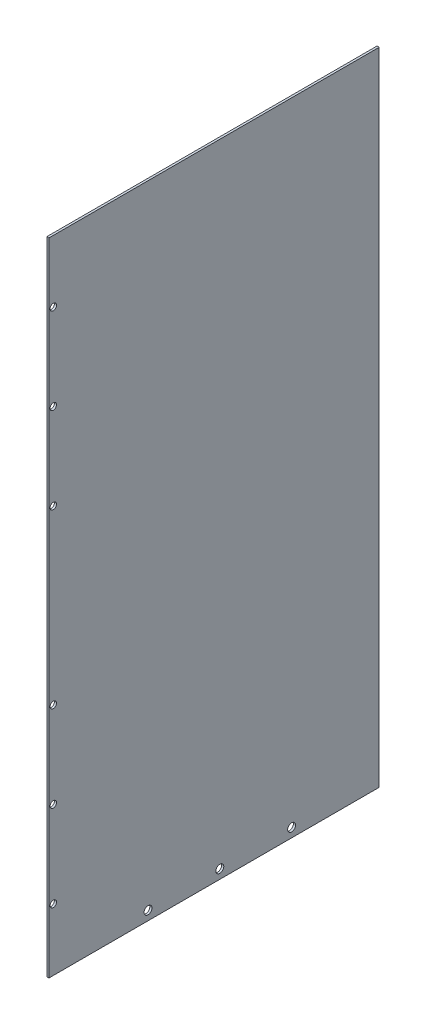
from build123d import *

# Parameters (mm, degrees)
SKETCH_1_W             = 1.5
SKETCH_1_H             = 446.43
SM_BASE_FLANGE_1_DEPTH = 230
SKETCH_10_R            = 2.75
CUT_EXTRUDE_1_DEPTH    = 20
SKETCH_11_R            = 2.25
CUT_EXTRUDE_2_DEPTH    = 10


# Sheet-metal steps are written as plain solids
with BuildPart() as part:
    # Sketch 1 → 基体-法兰1 (new body)
    with BuildSketch(Plane.XY):
        with Locations((0.75, 223.215)):
            Rectangle(SKETCH_1_W, SKETCH_1_H)
    extrude(amount=SM_BASE_FLANGE_1_DEPTH)

    # 草图10 → 切除-拉伸1 (cut)
    with BuildSketch(Plane(origin=(1.5, 0, 0), x_dir=(0, 0, -1), z_dir=(1, 0, 0))):
        with Locations((-161, 6.3817)):
            Circle(SKETCH_10_R)
        with Locations((-111, 6.3817)):
            Circle(SKETCH_10_R)
        with Locations((-61, 6.3817)):
            Circle(SKETCH_10_R)
    extrude(amount=-CUT_EXTRUDE_1_DEPTH, mode=Mode.SUBTRACT)

    # 草图11 → 切除-拉伸2 (cut)
    with BuildSketch(Plane.ZY):
        with Locations((227, 43.215)):
            Circle(SKETCH_11_R)
        with Locations((227, 103.215)):
            Circle(SKETCH_11_R)
        with Locations((227, 163.215)):
            Circle(SKETCH_11_R)
        with Locations((227, 403.215)):
            Circle(SKETCH_11_R)
        with Locations((227, 343.215)):
            Circle(SKETCH_11_R)
        with Locations((227, 283.215)):
            Circle(SKETCH_11_R)
    extrude(amount=-CUT_EXTRUDE_2_DEPTH, mode=Mode.SUBTRACT)


solid = part.part
